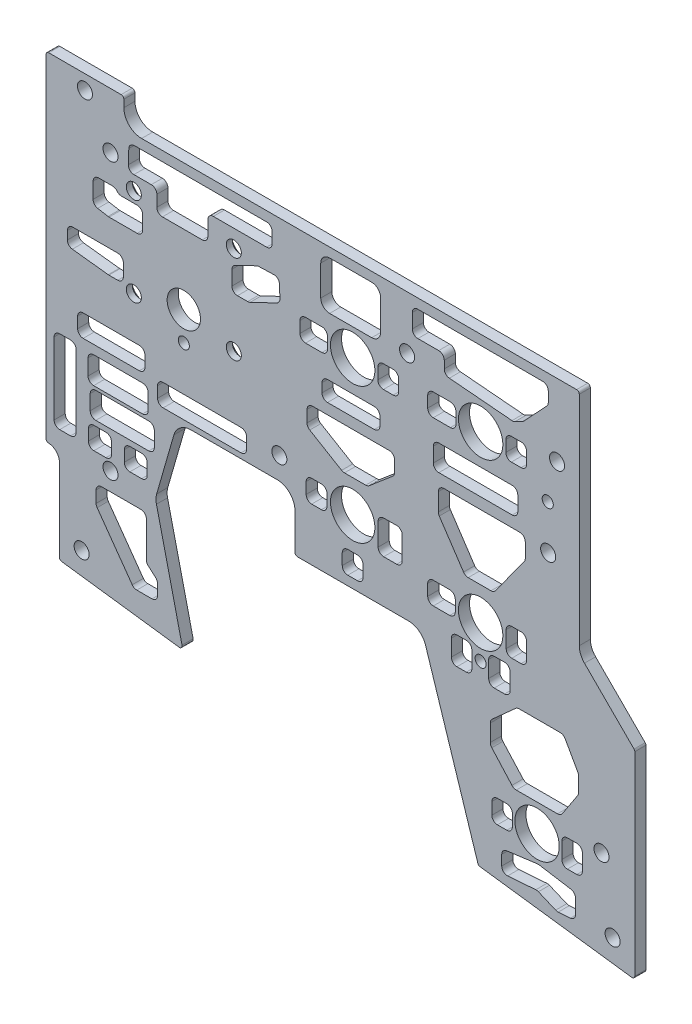
from build123d import *

# Parameters (mm, degrees)
BOSS_EXTRUDE1_DEPTH                       = 3.175
F_6_CLEARANCE_HOLE1_D                     = 4.3053
SKETCH4_R                                 = 6.35
SKETCH4_R_2                               = 1.5875
SKETCH4_R_3                               = 4.7625
CUT_EXTRUDE1_DEPTH                        = 218.405084842
CSK_FOR_6_FLAT_HEAD_MACHINE_SCREW_2_COUNT = 2
CSK_FOR_6_FLAT_HEAD_MACHINE_SCREW_2_PITCH = 28.575
CSK_FOR_6_FLAT_HEAD_MACHINE_SCREW_3_COUNT = 2
CSK_FOR_6_FLAT_HEAD_MACHINE_SCREW_3_PITCH = 38.232062788
CSK_FOR_6_FLAT_HEAD_MACHINE_SCREW_4_COUNT = 2
CSK_FOR_6_FLAT_HEAD_MACHINE_SCREW_4_PITCH = 25.4
F_0_CLEARANCE_HOLE1_D                     = 1.8542
F_1_8_0_125_DIAMETER_HOLE1_D              = 3.175
SKETCH17_R                                = 1.5875
CUT_EXTRUDE3_DEPTH                        = 218.405084842


with BuildPart() as part:
    # Sketch1 → Boss-Extrude1 (new body)
    with BuildSketch(Plane.XY):
        with BuildLine():
            Line((3.809986215, -91.884500325), (3.80998361, -115.403340545))
            ThreePointArc((3.80998361, -115.403340545), (3.999081622, -115.90576205), (4.472522544, -116.158821571))
            Line((4.472522544, -116.158821571), (38.023104274, -120.5758443))
            ThreePointArc((38.023104274, -120.5758443), (38.687459595, -120.33177166), (38.864463259, -119.646491316))
            Line((38.864463259, -119.646491316), (31.544635998, -88.413376307))
            ThreePointArc((31.544635998, -88.413376307), (31.412233483, -87.126289027), (31.609278422, -85.84750156))
            Line((31.609278422, -85.84750156), (36.533410401, -68.760772014))
            ThreePointArc((36.533410401, -68.760772014), (38.360231081, -66.108400459), (41.414754107, -65.0875))
            Line((41.414754107, -65.0875), (66.039990754, -65.0875))
            ThreePointArc((66.039990754, -65.0875), (69.632093202, -66.575397552), (71.119990754, -70.1675))
            Line((71.119990754, -70.1675), (71.119990754, -80.518))
            ThreePointArc((71.119990754, -80.518), (71.343175387, -81.056815367), (71.881990754, -81.28))
            Line((71.881990754, -81.28), (103.612235862, -81.28))
            ThreePointArc((103.612235862, -81.28), (106.604490402, -82.25478225), (108.448399818, -84.805034342))
            Line((108.448399818, -84.805034342), (123.423319929, -131.379161885))
            ThreePointArc((123.423319929, -131.379161885), (123.660593225, -131.731025839), (124.049283564, -131.901398021))
            Line((124.049283564, -131.901398021), (167.413526593, -137.610408921))
            ThreePointArc((167.413526593, -137.610408921), (168.015409063, -137.42782987), (168.274987552, -136.854927937))
            Line((168.274987552, -136.854927937), (168.274987552, -81.303553632))
            ThreePointArc((168.274987552, -81.303553632), (168.216983776, -81.011948907), (168.051802995, -80.764738341))
            Line((168.051802995, -80.764738341), (153.88788809, -66.600819412))
            ThreePointArc((153.88788809, -66.600819412), (152.786682817, -64.952748811), (152.399991049, -63.008717113))
            Line((152.399991049, -63.008717113), (152.399999892, -0.762021595))
            ThreePointArc((152.399999892, -0.762021595), (152.176815316, -0.223206231), (151.638, -2.1541e-05))
            Line((151.638, -2.1541e-05), (27.305, -3.804e-06))
            ThreePointArc((27.305, -3.804e-06), (23.712898123, 1.487894033), (22.22500087, 5.079996121))
            Line((22.22500087, 5.079996121), (22.225001755, 7.175496897))
            ThreePointArc((22.225001755, 7.175496897), (22.001816945, 7.7143128), (21.463001073, 7.937498421))
            Line((21.463001073, 7.937498421), (0.762001075, 7.937499892))
            ThreePointArc((0.762001075, 7.937499892), (0.223185691, 7.714315297), (1.021e-06, 7.175499945))
            Line((1.021e-06, 7.175499945), (-1.2342e-05, -87.949548922))
            ThreePointArc((-1.2342e-05, -87.949548922), (0.214550622, -88.479602508), (0.737406874, -88.711153328))
            ThreePointArc((0.737406874, -88.711153328), (2.915974038, -89.675944454), (3.809986215, -91.884500325))
        make_face()
    extrude(amount=-BOSS_EXTRUDE1_DEPTH)

    # #6 Clearance Hole1 (through all)
    with Locations(Plane(origin=(0, 0, -3.175), x_dir=(-1, 0, 0), z_dir=(0, 0, -1))):
        with Locations((-11.112500541, 3.81), (-18.414998872, -7.937503157), (-103.187497835, -15.240014658), (-143.510001128, -44.450020387), (-158.750001128, -111.125021649), (-18.414987678, -86.741003157), (-66.674991751, -58.7375), (-10.16, -110.502822935), (-146.049997068, -20.637520747), (-161.924987552, -130.483035149)):
            Hole(F_6_CLEARANCE_HOLE1_D / 2)

    # Sketch4 → Cut-Extrude1 (cut, through all)
    with BuildSketch(Plane(origin=(0, 0, -3.175), x_dir=(-1, 0, 0), z_dir=(0, 0, -1))):
        with Locations((-140.334987552, -115.57)):
            Circle(SKETCH4_R)
        with Locations((-124.205996572, -71.437521424)):
            Circle(SKETCH4_R)
        with Locations((-87.63, -62.992021649)):
            Circle(SKETCH4_R)
        with Locations((-87.63, -24.130021649)):
            Circle(SKETCH4_R)
        with Locations((-124.205996572, -24.130021649)):
            Circle(SKETCH4_R)
        with Locations((-124.205996572, -80.962521424)):
            Circle(SKETCH4_R_2)
        with Locations((-39.36999484, -36.322003157)):
            Circle(SKETCH4_R_3)
    extrude(amount=-CUT_EXTRUDE1_DEPTH, mode=Mode.SUBTRACT)

    # Sketch5 → CSK for #6 Flat Head Machine Screw (100)1 (revolve, cut)
    with BuildSketch(Plane(origin=(53.65749484, -14.097003157, -3.175), x_dir=(0, 1, 0), z_dir=(1, 0, 0))):
        Polygon((0, 0), (0, 3.175), (2.15265, 3.175), (2.15265, 1.420893136), (3.8460045, 0), align=None)
    csk_for_6_flat_head_machine_screw_100 = revolve(axis=Axis((53.65749484, -14.097003157, -9.525), (0, 0, 1)), mode=Mode.SUBTRACT)

    # CSK for _6 Flat Head Machine Screw _ 2: CSK for #6 Flat Head Machine Screw (100)1 ×2
    with Locations(*[(-i * CSK_FOR_6_FLAT_HEAD_MACHINE_SCREW_2_PITCH, 0, 0) for i in range(1, CSK_FOR_6_FLAT_HEAD_MACHINE_SCREW_2_COUNT)]):
        add(csk_for_6_flat_head_machine_screw_100, mode=Mode.SUBTRACT)

    # CSK for _6 Flat Head Machine Screw _ 3: CSK for #6 Flat Head Machine Screw (100)1 ×2
    with Locations(*[Vector(-0.7474093186836602, -0.6643638388299193, 0) * (i * CSK_FOR_6_FLAT_HEAD_MACHINE_SCREW_3_PITCH) for i in range(1, CSK_FOR_6_FLAT_HEAD_MACHINE_SCREW_3_COUNT)]):
        add(csk_for_6_flat_head_machine_screw_100, mode=Mode.SUBTRACT)

    # CSK for _6 Flat Head Machine Screw _ 4: CSK for #6 Flat Head Machine Screw (100)1 ×2
    with Locations(*[(0, -i * CSK_FOR_6_FLAT_HEAD_MACHINE_SCREW_4_PITCH, 0) for i in range(1, CSK_FOR_6_FLAT_HEAD_MACHINE_SCREW_4_COUNT)]):
        add(csk_for_6_flat_head_machine_screw_100, mode=Mode.SUBTRACT)

    # #0 Clearance Hole1 (through all)
    with Locations(Plane(origin=(0, 0, -9.525), x_dir=(-1, 0, 0), z_dir=(0, 0, -1))):
        with Locations((-39.36999484, -44.577003157)):
            Hole(F_0_CLEARANCE_HOLE1_D / 2)

    # 1/8 (0.125) Diameter Hole1 (through all)
    with Locations(Plane.XY):
        with Locations((39.36999484, -44.577003157)):
            Hole(F_1_8_0_125_DIAMETER_HOLE1_D / 2)

    # Sketch17 → Cut-Extrude3 (cut, through all)
    with BuildSketch(Plane(origin=(0, 0, 0), x_dir=(-1, 0, 0), z_dir=(0, 0, -1))):
        with Locations((-143.386523366, -31.863003467)):
            Circle(SKETCH17_R)
        with BuildLine():
            Line((-141.954401082, -2.794778722), (-106.266230354, -2.794778722))
            ThreePointArc((-106.266230354, -2.794778722), (-105.143698339, -3.259746707), (-104.678730354, -4.382278722))
            Line((-104.678730354, -4.382278722), (-104.678730354, -8.460645735))
            ThreePointArc((-104.678730354, -8.460645735), (-105.143698339, -9.58317775), (-106.266230354, -10.048145735))
            Line((-106.266230354, -10.048145735), (-112.220916292, -10.048145735))
            ThreePointArc((-112.220916292, -10.048145735), (-113.343448308, -10.513113719), (-113.808416292, -11.635645735))
            Line((-113.808416292, -11.635645735), (-113.808416292, -13.776242931))
            ThreePointArc((-113.808416292, -13.776242931), (-114.2259722, -14.849269991), (-115.258982682, -15.357826136))
            Line((-115.258982682, -15.357826136), (-133.159037644, -16.907614445))
            ThreePointArc((-133.159037644, -16.907614445), (-133.597603316, -16.884612116), (-134.01308492, -16.742330728))
            Line((-134.01308492, -16.742330728), (-136.087372049, -15.692058763))
            ThreePointArc((-136.087372049, -15.692058763), (-136.323169987, -15.545450468), (-136.529817195, -15.360000768))
            Line((-136.529817195, -15.360000768), (-143.113959892, -8.318487666))
            ThreePointArc((-143.113959892, -8.318487666), (-143.431045227, -7.817065459), (-143.541901082, -7.234246174))
            Line((-143.541901082, -7.234246174), (-143.541901082, -4.382278722))
            ThreePointArc((-143.541901082, -4.382278722), (-143.076933097, -3.259746707), (-141.954401082, -2.794778722))
        make_face()
        with BuildLine():
            Line((-93.066886854, -2.707621709), (-81.044131338, -2.707621709))
            ThreePointArc((-81.044131338, -2.707621709), (-79.248080114, -3.451570485), (-78.504131338, -5.247621709))
            Line((-78.504131338, -5.247621709), (-78.504131338, -13.895603213))
            ThreePointArc((-78.504131338, -13.895603213), (-79.248080114, -15.691654437), (-81.044131338, -16.435603213))
            Line((-81.044131338, -16.435603213), (-93.066886854, -16.435603213))
            ThreePointArc((-93.066886854, -16.435603213), (-94.862938078, -15.691654437), (-95.606886854, -13.895603213))
            Line((-95.606886854, -13.895603213), (-95.606886854, -5.247621709))
            ThreePointArc((-95.606886854, -5.247621709), (-94.862938078, -3.451570485), (-93.066886854, -2.707621709))
        make_face()
        with BuildLine():
            Line((-72.561223983, -22.437005333), (-72.561223983, -25.636983817))
            ThreePointArc((-72.561223983, -25.636983817), (-73.026191968, -26.759515832), (-74.148723983, -27.224483817))
            Line((-74.148723983, -27.224483817), (-78.851026484, -27.224483817))
            ThreePointArc((-78.851026484, -27.224483817), (-79.973558499, -26.759515832), (-80.438526484, -25.636983817))
            Line((-80.438526484, -25.636983817), (-80.438526484, -22.437005333))
            ThreePointArc((-80.438526484, -22.437005333), (-79.973558499, -21.314473318), (-78.851026484, -20.849505333))
            Line((-78.851026484, -20.849505333), (-74.148723983, -20.849505333))
            ThreePointArc((-74.148723983, -20.849505333), (-73.026191968, -21.314473318), (-72.561223983, -22.437005333))
        make_face()
        with BuildLine():
            Line((-99.201764697, -21.196263474), (-96.421279554, -21.196263474))
            ThreePointArc((-96.421279554, -21.196263474), (-95.298747539, -21.661231459), (-94.833779554, -22.783763474))
            Line((-94.833779554, -22.783763474), (-94.833779554, -25.981791856))
            ThreePointArc((-94.833779554, -25.981791856), (-95.298747539, -27.104323871), (-96.421279554, -27.569291856))
            Line((-96.421279554, -27.569291856), (-99.201764697, -27.569291856))
            ThreePointArc((-99.201764697, -27.569291856), (-100.324296712, -27.104323871), (-100.789264697, -25.981791856))
            Line((-100.789264697, -25.981791856), (-100.789264697, -22.783763474))
            ThreePointArc((-100.789264697, -22.783763474), (-100.324296712, -21.661231459), (-99.201764697, -21.196263474))
        make_face()
        with BuildLine():
            Line((-109.079202691, -22.654901792), (-109.079202691, -25.854880276))
            ThreePointArc((-109.079202691, -25.854880276), (-109.544170675, -26.977412291), (-110.666702691, -27.442380276))
            Line((-110.666702691, -27.442380276), (-115.553648816, -27.442380276))
            ThreePointArc((-115.553648816, -27.442380276), (-116.676180832, -26.977412291), (-117.141148816, -25.854880276))
            Line((-117.141148816, -25.854880276), (-117.141148816, -22.654901792))
            ThreePointArc((-117.141148816, -22.654901792), (-116.676180832, -21.532369777), (-115.553648816, -21.067401792))
            Line((-115.553648816, -21.067401792), (-110.666702691, -21.067401792))
            ThreePointArc((-110.666702691, -21.067401792), (-109.544170675, -21.532369777), (-109.079202691, -22.654901792))
        make_face()
        with BuildLine():
            Line((-135.77376345, -20.881443358), (-132.993278308, -20.881443358))
            ThreePointArc((-132.993278308, -20.881443358), (-131.870746293, -21.346411343), (-131.405778308, -22.468943358))
            Line((-131.405778308, -22.468943358), (-131.405778308, -25.666971739))
            ThreePointArc((-131.405778308, -25.666971739), (-131.870746293, -26.789503754), (-132.993278308, -27.254471739))
            Line((-132.993278308, -27.254471739), (-135.77376345, -27.254471739))
            ThreePointArc((-135.77376345, -27.254471739), (-136.896295465, -26.789503754), (-137.36126345, -25.666971739))
            Line((-137.36126345, -25.666971739), (-137.36126345, -22.468943358))
            ThreePointArc((-137.36126345, -22.468943358), (-136.896295465, -21.346411343), (-135.77376345, -20.881443358))
        make_face()
        with BuildLine():
            Line((-93.818924612, -33.08533813), (-80.438526484, -33.08533813))
            ThreePointArc((-80.438526484, -33.08533813), (-79.315994469, -33.550306115), (-78.851026484, -34.67283813))
            Line((-78.851026484, -34.67283813), (-78.851026484, -37.195409517))
            ThreePointArc((-78.851026484, -37.195409517), (-79.315994469, -38.317941532), (-80.438526484, -38.782909517))
            Line((-80.438526484, -38.782909517), (-93.818924612, -38.782909517))
            ThreePointArc((-93.818924612, -38.782909517), (-94.941456627, -38.317941532), (-95.406424612, -37.195409517))
            Line((-95.406424612, -37.195409517), (-95.406424612, -34.67283813))
            ThreePointArc((-95.406424612, -34.67283813), (-94.941456627, -33.550306115), (-93.818924612, -33.08533813))
        make_face()
        with BuildLine():
            Line((-133.234599807, -32.906340689), (-112.254202691, -32.906340689))
            ThreePointArc((-112.254202691, -32.906340689), (-111.131670675, -33.371308674), (-110.666702691, -34.493840689))
            Line((-110.666702691, -34.493840689), (-110.666702691, -38.654468066))
            ThreePointArc((-110.666702691, -38.654468066), (-111.131670675, -39.777000081), (-112.254202691, -40.241968066))
            Line((-112.254202691, -40.241968066), (-133.234599807, -40.241968066))
            ThreePointArc((-133.234599807, -40.241968066), (-134.357131822, -39.777000081), (-134.822099807, -38.654468066))
            Line((-134.822099807, -38.654468066), (-134.822099807, -34.493840689))
            ThreePointArc((-134.822099807, -34.493840689), (-134.357131822, -33.371308674), (-133.234599807, -32.906340689))
        make_face()
        with BuildLine():
            Line((-98.049772798, -41.846894397), (-76.171732084, -41.846894397))
            ThreePointArc((-76.171732084, -41.846894397), (-75.049200069, -42.311862382), (-74.584232084, -43.434394397))
            Line((-74.584232084, -43.434394397), (-74.584232084, -46.777135575))
            ThreePointArc((-74.584232084, -46.777135575), (-74.791626469, -47.561651185), (-75.359620735, -48.14118521))
            Line((-75.359620735, -48.14118521), (-84.465669031, -53.562633937))
            ThreePointArc((-84.465669031, -53.562633937), (-84.856634648, -53.729202648), (-85.277780379, -53.786084302))
            Line((-85.277780379, -53.786084302), (-91.347435578, -53.786084302))
            ThreePointArc((-91.347435578, -53.786084302), (-91.895147409, -53.68860712), (-92.375596997, -53.408146349))
            Line((-92.375596997, -53.408146349), (-99.077934217, -47.710973092))
            ThreePointArc((-99.077934217, -47.710973092), (-99.490668787, -47.167725534), (-99.637272798, -46.501411045))
            Line((-99.637272798, -46.501411045), (-99.637272798, -43.434394397))
            ThreePointArc((-99.637272798, -43.434394397), (-99.172304813, -42.311862382), (-98.049772798, -41.846894397))
        make_face()
        with BuildLine():
            Line((-135.378861596, -43.434394397), (-113.69903477, -43.434394397))
            ThreePointArc((-113.69903477, -43.434394397), (-112.576502755, -43.899362382), (-112.11153477, -45.021894397))
            Line((-112.11153477, -45.021894397), (-112.11153477, -50.042866363))
            ThreePointArc((-112.11153477, -50.042866363), (-112.179838766, -50.503517806), (-112.37887304, -50.924529143))
            Line((-112.37887304, -50.924529143), (-119.322930241, -61.322244422))
            ThreePointArc((-119.322930241, -61.322244422), (-119.894587933, -61.840545197), (-120.64309197, -62.028081642))
            Line((-120.64309197, -62.028081642), (-127.16320926, -62.028081642))
            ThreePointArc((-127.16320926, -62.028081642), (-127.884632872, -61.854690627), (-128.448464835, -61.372394047))
            Line((-128.448464835, -61.372394047), (-136.664117171, -50.040485491))
            ThreePointArc((-136.664117171, -50.040485491), (-136.888911177, -49.59847561), (-136.966361596, -49.108673086))
            Line((-136.966361596, -49.108673086), (-136.966361596, -45.021894397))
            ThreePointArc((-136.966361596, -45.021894397), (-136.501393611, -43.899362382), (-135.378861596, -43.434394397))
        make_face()
        with BuildLine():
            Line((-55.728459479, -57.317644253), (-33.458660867, -57.317644253))
            ThreePointArc((-33.458660867, -57.317644253), (-32.336128852, -57.782612238), (-31.871160867, -58.905144253))
            Line((-31.871160867, -58.905144253), (-31.871160867, -62.020016774))
            ThreePointArc((-31.871160867, -62.020016774), (-32.336128852, -63.142548789), (-33.458660867, -63.607516774))
            Line((-33.458660867, -63.607516774), (-55.728459479, -63.607516774))
            ThreePointArc((-55.728459479, -63.607516774), (-56.850991494, -63.142548789), (-57.315959479, -62.020016774))
            Line((-57.315959479, -62.020016774), (-57.315959479, -58.905144253))
            ThreePointArc((-57.315959479, -58.905144253), (-56.850991494, -57.782612238), (-55.728459479, -57.317644253))
        make_face()
        with BuildLine():
            Line((-78.702060135, -59.817431846), (-75.921574993, -59.817431846))
            ThreePointArc((-75.921574993, -59.817431846), (-74.799042977, -60.282399831), (-74.334074993, -61.404931846))
            Line((-74.334074993, -61.404931846), (-74.334074993, -64.602960227))
            ThreePointArc((-74.334074993, -64.602960227), (-74.799042977, -65.725492242), (-75.921574993, -66.190460227))
            Line((-75.921574993, -66.190460227), (-78.702060135, -66.190460227))
            ThreePointArc((-78.702060135, -66.190460227), (-79.82459215, -65.725492242), (-80.289560135, -64.602960227))
            Line((-80.289560135, -64.602960227), (-80.289560135, -61.404931846))
            ThreePointArc((-80.289560135, -61.404931846), (-79.82459215, -60.282399831), (-78.702060135, -59.817431846))
        make_face()
        with BuildLine():
            Line((-89.018858203, -72.254815082), (-86.23837306, -72.254815082))
            ThreePointArc((-86.23837306, -72.254815082), (-85.115841045, -72.719783067), (-84.65087306, -73.842315082))
            Line((-84.65087306, -73.842315082), (-84.65087306, -77.040343463))
            ThreePointArc((-84.65087306, -77.040343463), (-85.115841045, -78.162875478), (-86.23837306, -78.627843463))
            Line((-86.23837306, -78.627843463), (-89.018858203, -78.627843463))
            ThreePointArc((-89.018858203, -78.627843463), (-90.141390218, -78.162875478), (-90.606358203, -77.040343463))
            Line((-90.606358203, -77.040343463), (-90.606358203, -73.842315082))
            ThreePointArc((-90.606358203, -73.842315082), (-90.141390218, -72.719783067), (-89.018858203, -72.254815082))
        make_face()
        with BuildLine():
            Line((-109.075626661, -69.247984793), (-109.075626661, -72.447963277))
            ThreePointArc((-109.075626661, -72.447963277), (-109.540594645, -73.570495292), (-110.663126661, -74.035463277))
            Line((-110.663126661, -74.035463277), (-115.365429161, -74.035463277))
            ThreePointArc((-115.365429161, -74.035463277), (-116.487961176, -73.570495292), (-116.952929161, -72.447963277))
            Line((-116.952929161, -72.447963277), (-116.952929161, -69.247984793))
            ThreePointArc((-116.952929161, -69.247984793), (-116.487961176, -68.125452778), (-115.365429161, -67.660484793))
            Line((-115.365429161, -67.660484793), (-110.663126661, -67.660484793))
            ThreePointArc((-110.663126661, -67.660484793), (-109.540594645, -68.125452778), (-109.075626661, -69.247984793))
        make_face()
        with BuildLine():
            Line((-148.370050761, -88.076585208), (-151.957151361, -94.466108152))
            ThreePointArc((-151.957151361, -94.466108152), (-152.115789699, -94.859097254), (-152.169841465, -95.27943636))
            Line((-152.169841465, -95.27943636), (-152.169841465, -99.49161714))
            ThreePointArc((-152.169841465, -99.49161714), (-152.099935986, -99.968481356), (-151.89610216, -100.405217006))
            Line((-151.89610216, -100.405217006), (-147.55983031, -106.991698188))
            ThreePointArc((-147.55983031, -106.991698188), (-146.96032319, -107.540670714), (-146.17213864, -107.739529297))
            Line((-146.17213864, -107.739529297), (-134.392603774, -107.739529297))
            ThreePointArc((-134.392603774, -107.739529297), (-133.716535226, -107.595755795), (-133.157475142, -107.189318439))
            Line((-133.157475142, -107.189318439), (-127.395632153, -100.784991214))
            ThreePointArc((-127.395632153, -100.784991214), (-127.07956224, -100.268864333), (-126.96932981, -99.673771097))
            Line((-126.96932981, -99.673771097), (-126.96932981, -94.86683815))
            ThreePointArc((-126.96932981, -94.86683815), (-127.113103312, -94.190769602), (-127.519540668, -93.631709518))
            Line((-127.519540668, -93.631709518), (-134.162932699, -87.654784784))
            ThreePointArc((-134.162932699, -87.654784784), (-134.67905958, -87.338714871), (-135.274152816, -87.228482441))
            Line((-135.274152816, -87.228482441), (-146.92130989, -87.228482441))
            ThreePointArc((-146.92130989, -87.228482441), (-147.760673997, -87.456100045), (-148.370050761, -88.076585208))
        make_face()
        with BuildLine():
            Line((-137.36126345, -69.47417269), (-137.36126345, -74.171525295))
            ThreePointArc((-137.36126345, -74.171525295), (-136.896295465, -75.29405731), (-135.77376345, -75.759025295))
            Line((-135.77376345, -75.759025295), (-133.093247086, -75.759025295))
            ThreePointArc((-133.093247086, -75.759025295), (-131.970715071, -75.29405731), (-131.505747086, -74.171525295))
            Line((-131.505747086, -74.171525295), (-131.505747086, -69.481799172))
            ThreePointArc((-131.505747086, -69.481799172), (-131.969119323, -68.360865176), (-133.088730422, -67.894305597))
            Line((-133.088730422, -67.894305597), (-135.769246787, -67.886679115))
            ThreePointArc((-135.769246787, -67.886679115), (-136.894697446, -68.350044928), (-137.36126345, -69.47417269))
        make_face()
        with BuildLine():
            Line((-132.626442112, -79.356885677), (-132.626442112, -84.055009483))
            ThreePointArc((-132.626442112, -84.055009483), (-132.161474127, -85.177541498), (-131.038942112, -85.642509483))
            Line((-131.038942112, -85.642509483), (-128.087367926, -85.642509483))
            ThreePointArc((-128.087367926, -85.642509483), (-126.964835911, -85.177541498), (-126.499867926, -84.055009483))
            Line((-126.499867926, -84.055009483), (-126.499867926, -79.36528336))
            ThreePointArc((-126.499867926, -79.36528336), (-126.963240164, -78.244349364), (-128.082851263, -77.777789785))
            Line((-128.082851263, -77.777789785), (-131.034425449, -77.769392102))
            ThreePointArc((-131.034425449, -77.769392102), (-132.159876108, -78.232757914), (-132.626442112, -79.356885677))
        make_face()
        with BuildLine():
            Line((-121.693780245, -79.413986581), (-121.693780245, -84.111339186))
            ThreePointArc((-121.693780245, -84.111339186), (-121.22881226, -85.233871201), (-120.106280245, -85.698839186))
            Line((-120.106280245, -85.698839186), (-117.42576388, -85.698839186))
            ThreePointArc((-117.42576388, -85.698839186), (-116.303231865, -85.233871201), (-115.83826388, -84.111339186))
            Line((-115.83826388, -84.111339186), (-115.83826388, -79.421613063))
            ThreePointArc((-115.83826388, -79.421613063), (-116.301636118, -78.300679067), (-117.421247217, -77.834119488))
            Line((-117.421247217, -77.834119488), (-120.101763581, -77.826493007))
            ThreePointArc((-120.101763581, -77.826493007), (-121.227214241, -78.289858819), (-121.693780245, -79.413986581))
        make_face()
        with BuildLine():
            Line((-101.797793639, -60.937531848), (-101.797793639, -67.347277648))
            ThreePointArc((-101.797793639, -67.347277648), (-101.332825654, -68.469809663), (-100.210293639, -68.934777648))
            Line((-100.210293639, -68.934777648), (-96.497621556, -68.934777648))
            ThreePointArc((-96.497621556, -68.934777648), (-95.375089541, -68.469809663), (-94.910121556, -67.347277648))
            Line((-94.910121556, -67.347277648), (-94.910121556, -60.948094972))
            ThreePointArc((-94.910121556, -60.948094972), (-95.373493794, -59.827160976), (-96.493104893, -59.360601397))
            Line((-96.493104893, -59.360601397), (-100.205776975, -59.350038274))
            ThreePointArc((-100.205776975, -59.350038274), (-101.331227635, -59.813404086), (-101.797793639, -60.937531848))
        make_face()
        with BuildLine():
            Line((-153.280142062, -113.845353265), (-153.280142062, -118.411545226))
            ThreePointArc((-153.280142062, -118.411545226), (-152.815174077, -119.534077241), (-151.692642062, -119.999045226))
            Line((-151.692642062, -119.999045226), (-149.012125698, -119.999045226))
            ThreePointArc((-149.012125698, -119.999045226), (-147.889593683, -119.534077241), (-147.424625698, -118.411545226))
            Line((-147.424625698, -118.411545226), (-147.424625698, -113.852979747))
            ThreePointArc((-147.424625698, -113.852979747), (-147.887997935, -112.732045751), (-149.007609034, -112.265486172))
            Line((-149.007609034, -112.265486172), (-151.688125399, -112.25785969))
            ThreePointArc((-151.688125399, -112.25785969), (-152.813576058, -112.721225502), (-153.280142062, -113.845353265))
        make_face()
        with BuildLine():
            Line((-133.269582538, -114.060259814), (-133.269582538, -117.452210954))
            ThreePointArc((-133.269582538, -117.452210954), (-132.804614553, -118.57474297), (-131.682082538, -119.039710954))
            Line((-131.682082538, -119.039710954), (-129.001566173, -119.039710954))
            ThreePointArc((-129.001566173, -119.039710954), (-127.879034158, -118.57474297), (-127.414066173, -117.452210954))
            Line((-127.414066173, -117.452210954), (-127.414066173, -114.067886296))
            ThreePointArc((-127.414066173, -114.067886296), (-127.877438411, -112.9469523), (-128.99704951, -112.480392721))
            Line((-128.99704951, -112.480392721), (-131.677565874, -112.47276624))
            ThreePointArc((-131.677565874, -112.47276624), (-132.803016533, -112.936132052), (-133.269582538, -114.060259814))
        make_face()
        with BuildLine():
            Line((-150.008386995, -124.475096267), (-140.89017679, -122.992460461))
            ThreePointArc((-140.89017679, -122.992460461), (-140.658124621, -122.972044218), (-140.425582982, -122.985807167))
            Line((-140.425582982, -122.985807167), (-131.613885455, -124.16070017))
            ThreePointArc((-131.613885455, -124.16070017), (-130.629285574, -124.688549111), (-130.23619536, -125.734274463))
            Line((-130.23619536, -125.734274463), (-130.23619536, -128.629666423))
            ThreePointArc((-130.23619536, -128.629666423), (-130.742753538, -129.792301803), (-131.939150985, -130.212962431))
            Line((-131.939150985, -130.212962431), (-139.978069251, -129.626755984))
            ThreePointArc((-139.978069251, -129.626755984), (-140.352556122, -129.64382753), (-140.712598595, -129.748236689))
            Line((-140.712598595, -129.748236689), (-145.647124424, -131.837991292))
            ThreePointArc((-145.647124424, -131.837991292), (-146.007166897, -131.94240045), (-146.381653768, -131.959471997))
            Line((-146.381653768, -131.959471997), (-149.869058718, -131.705166729))
            ThreePointArc((-149.869058718, -131.705166729), (-150.916238473, -131.202812543), (-151.341103093, -130.121870721))
            Line((-151.341103093, -130.121870721), (-151.341103093, -126.042017265))
            ThreePointArc((-151.341103093, -126.042017265), (-150.962864375, -125.01350212), (-150.008386995, -124.475096267))
        make_face()
        with BuildLine():
            Line((-63.040443501, -2.794778722), (-25.227680135, -2.794778722))
            ThreePointArc((-25.227680135, -2.794778722), (-24.123242224, -3.241939671), (-23.640992035, -4.331513335))
            Line((-23.640992035, -4.331513335), (-23.510506479, -8.409880348))
            ThreePointArc((-23.510506479, -8.409880348), (-23.956855528, -9.565083646), (-25.097194578, -10.048145735))
            Line((-25.097194578, -10.048145735), (-30.072502828, -10.048145735))
            ThreePointArc((-30.072502828, -10.048145735), (-31.195034843, -10.513113719), (-31.660002828, -11.635645735))
            Line((-31.660002828, -11.635645735), (-31.660002828, -14.848103213))
            ThreePointArc((-31.660002828, -14.848103213), (-32.124970813, -15.970635228), (-33.247502828, -16.435603213))
            Line((-33.247502828, -16.435603213), (-44.640077745, -16.435603213))
            ThreePointArc((-44.640077745, -16.435603213), (-45.76260976, -15.970635228), (-46.227577745, -14.848103213))
            Line((-46.227577745, -14.848103213), (-46.227577745, -10.622419331))
            ThreePointArc((-46.227577745, -10.622419331), (-46.69254573, -9.499887316), (-47.815077745, -9.034919331))
            Line((-47.815077745, -9.034919331), (-63.040443501, -9.034919331))
            ThreePointArc((-63.040443501, -9.034919331), (-64.162975516, -8.569951347), (-64.627943501, -7.447419331))
            Line((-64.627943501, -7.447419331), (-64.627943501, -4.382278722))
            ThreePointArc((-64.627943501, -4.382278722), (-64.162975516, -3.259746707), (-63.040443501, -2.794778722))
        make_face()
        with BuildLine():
            Line((-14.759070115, -23.570795807), (-17.723350514, -24.090332102))
            ThreePointArc((-17.723350514, -24.090332102), (-17.85986161, -24.1081969), (-17.997407205, -24.114166799))
            Line((-17.997407205, -24.114166799), (-26.038134643, -24.114166799))
            ThreePointArc((-26.038134643, -24.114166799), (-27.160666659, -23.649198814), (-27.625634643, -22.526666799))
            Line((-27.625634643, -22.526666799), (-27.625634643, -18.73663863))
            ThreePointArc((-27.625634643, -18.73663863), (-27.160666659, -17.614106615), (-26.038134643, -17.14913863))
            Line((-26.038134643, -17.14913863), (-21.56318401, -17.14913863))
            ThreePointArc((-21.56318401, -17.14913863), (-20.962036583, -17.030916691), (-20.45042467, -16.693858971))
            Line((-20.45042467, -16.693858971), (-20.120376939, -16.369484217))
            ThreePointArc((-20.120376939, -16.369484217), (-19.608765026, -16.032426497), (-19.007617599, -15.914204558))
            Line((-19.007617599, -15.914204558), (-15.033126806, -15.914204558))
            ThreePointArc((-15.033126806, -15.914204558), (-13.910594791, -16.379172543), (-13.445626806, -17.501704558))
            Line((-13.445626806, -17.501704558), (-13.445626806, -22.007130504))
            ThreePointArc((-13.445626806, -22.007130504), (-13.817556725, -23.02818174), (-14.759070115, -23.570795807))
        make_face()
        with BuildLine():
            Line((-7.687541654, -31.784293999), (-20.492686013, -31.784293999))
            ThreePointArc((-20.492686013, -31.784293999), (-21.615218028, -32.249261984), (-22.080186013, -33.371793999))
            Line((-22.080186013, -33.371793999), (-22.080186013, -36.910471607))
            ThreePointArc((-22.080186013, -36.910471607), (-21.615218028, -38.033003622), (-20.492686013, -38.497971607))
            Line((-20.492686013, -38.497971607), (-17.950353288, -38.497971607))
            ThreePointArc((-17.950353288, -38.497971607), (-17.85932805, -38.495359823), (-17.768602325, -38.487533064))
            Line((-17.768602325, -38.487533064), (-7.505790692, -37.304778971))
            ThreePointArc((-7.505790692, -37.304778971), (-6.502491887, -36.784038157), (-6.100041654, -35.727717515))
            Line((-6.100041654, -35.727717515), (-6.100041654, -33.371793999))
            ThreePointArc((-6.100041654, -33.371793999), (-6.565009639, -32.249261984), (-7.687541654, -31.784293999))
        make_face()
        with BuildLine():
            Line((-54.017740764, -18.035287573), (-60.157042526, -15.096331818))
            ThreePointArc((-60.157042526, -15.096331818), (-60.467014119, -14.985764634), (-60.793122931, -14.941486718))
            Line((-60.793122931, -14.941486718), (-65.080511102, -14.808059257))
            ThreePointArc((-65.080511102, -14.808059257), (-66.216963147, -15.237884918), (-66.716623456, -16.345410507))
            Line((-66.716623456, -16.345410507), (-66.828160076, -19.929386283))
            ThreePointArc((-66.828160076, -19.929386283), (-66.597618952, -20.803935361), (-65.926889232, -21.410653537))
            Line((-65.926889232, -21.410653537), (-58.302186243, -25.06068828))
            ThreePointArc((-58.302186243, -25.06068828), (-57.968176642, -25.176909518), (-57.616725286, -25.216301578))
            Line((-57.616725286, -25.216301578), (-54.703201722, -25.216301578))
            ThreePointArc((-54.703201722, -25.216301578), (-53.580669707, -24.751333593), (-53.115701722, -23.628801578))
            Line((-53.115701722, -23.628801578), (-53.115701722, -19.467174274))
            ThreePointArc((-53.115701722, -19.467174274), (-53.360010462, -18.621010289), (-54.017740764, -18.035287573))
        make_face()
        with BuildLine():
            Line((-24.6224405, -111.814164533), (-14.598619876, -97.7476148))
            ThreePointArc((-14.598619876, -97.7476148), (-14.379412328, -97.309967584), (-14.303951845, -96.826342988))
            Line((-14.303951845, -96.826342988), (-14.303951845, -93.511282851))
            ThreePointArc((-14.303951845, -93.511282851), (-14.76891983, -92.388750836), (-15.891451845, -91.923782851))
            Line((-15.891451845, -91.923782851), (-27.085798239, -91.923782851))
            ThreePointArc((-27.085798239, -91.923782851), (-28.208330254, -92.388750836), (-28.673298239, -93.511282851))
            Line((-28.673298239, -93.511282851), (-28.673298239, -103.655996614))
            ThreePointArc((-28.673298239, -103.655996614), (-28.814136203, -104.309697772), (-29.2116607, -104.847410343))
            Line((-29.2116607, -104.847410343), (-31.332798405, -106.715246122))
            ThreePointArc((-31.332798405, -106.715246122), (-31.730322903, -107.252958694), (-31.871160867, -107.906659851))
            Line((-31.871160867, -107.906659851), (-31.871160867, -110.892892721))
            ThreePointArc((-31.871160867, -110.892892721), (-31.406192882, -112.015424736), (-30.283660867, -112.480392721))
            Line((-30.283660867, -112.480392721), (-25.915272469, -112.480392721))
            ThreePointArc((-25.915272469, -112.480392721), (-25.188073304, -112.304040348), (-24.6224405, -111.814164533))
        make_face()
        with BuildLine():
            Line((-2.29761601, -61.626856011), (-2.29761601, -82.185869764))
            ThreePointArc((-2.29761601, -82.185869764), (-2.762583995, -83.308401779), (-3.88511601, -83.773369764))
            Line((-3.88511601, -83.773369764), (-6.992649062, -83.773369764))
            ThreePointArc((-6.992649062, -83.773369764), (-8.115181078, -83.308401779), (-8.580149062, -82.185869764))
            Line((-8.580149062, -82.185869764), (-8.580149062, -61.626856011))
            ThreePointArc((-8.580149062, -61.626856011), (-8.115181078, -60.504323996), (-6.992649062, -60.039356011))
            Line((-6.992649062, -60.039356011), (-3.88511601, -60.039356011))
            ThreePointArc((-3.88511601, -60.039356011), (-2.762583995, -60.504323996), (-2.29761601, -61.626856011))
        make_face()
        with BuildLine():
            Line((-26.655047824, -51.539248395), (-10.603917238, -51.539248395))
            ThreePointArc((-10.603917238, -51.539248395), (-9.481385223, -52.00421638), (-9.016417238, -53.126748395))
            Line((-9.016417238, -53.126748395), (-9.016417238, -56.241620915))
            ThreePointArc((-9.016417238, -56.241620915), (-9.481385223, -57.364152931), (-10.603917238, -57.829120915))
            Line((-10.603917238, -57.829120915), (-26.655047824, -57.829120915))
            ThreePointArc((-26.655047824, -57.829120915), (-27.777579839, -57.364152931), (-28.242547824, -56.241620915))
            Line((-28.242547824, -56.241620915), (-28.242547824, -53.126748395))
            ThreePointArc((-28.242547824, -53.126748395), (-27.777579839, -52.00421638), (-26.655047824, -51.539248395))
        make_face()
        with BuildLine():
            Line((-27.60517637, -60.384955933), (-13.586583905, -60.384955933))
            ThreePointArc((-13.586583905, -60.384955933), (-12.464051889, -60.849923918), (-11.999083905, -61.972455933))
            Line((-11.999083905, -61.972455933), (-11.999083905, -66.454374219))
            ThreePointArc((-11.999083905, -66.454374219), (-12.464051889, -67.576906234), (-13.586583905, -68.041874219))
            Line((-13.586583905, -68.041874219), (-27.60517637, -68.041874219))
            ThreePointArc((-27.60517637, -68.041874219), (-28.727708385, -67.576906234), (-29.19267637, -66.454374219))
            Line((-29.19267637, -66.454374219), (-29.19267637, -61.972455933))
            ThreePointArc((-29.19267637, -61.972455933), (-28.727708385, -60.849923918), (-27.60517637, -60.384955933))
        make_face()
        with BuildLine():
            Line((-29.346999145, -68.903193864), (-14.201372964, -68.903193864))
            ThreePointArc((-14.201372964, -68.903193864), (-13.078840949, -69.368161849), (-12.613872964, -70.490693864))
            Line((-12.613872964, -70.490693864), (-12.613872964, -74.741182613))
            ThreePointArc((-12.613872964, -74.741182613), (-13.078840949, -75.863714628), (-14.201372964, -76.328682613))
            Line((-14.201372964, -76.328682613), (-29.346999145, -76.328682613))
            ThreePointArc((-29.346999145, -76.328682613), (-30.46953116, -75.863714628), (-30.934499145, -74.741182613))
            Line((-30.934499145, -74.741182613), (-30.934499145, -70.490693864))
            ThreePointArc((-30.934499145, -70.490693864), (-30.46953116, -69.368161849), (-29.346999145, -68.903193864))
        make_face()
        with BuildLine():
            Line((-27.328678764, -77.907601358), (-23.948133638, -77.907601358))
            ThreePointArc((-23.948133638, -77.907601358), (-22.825601623, -78.372569343), (-22.360633638, -79.495101358))
            Line((-22.360633638, -79.495101358), (-22.360633638, -82.609973878))
            ThreePointArc((-22.360633638, -82.609973878), (-22.825601623, -83.732505893), (-23.948133638, -84.197473878))
            Line((-23.948133638, -84.197473878), (-27.328678764, -84.197473878))
            ThreePointArc((-27.328678764, -84.197473878), (-28.45121078, -83.732505893), (-28.916178764, -82.609973878))
            Line((-28.916178764, -82.609973878), (-28.916178764, -79.495101358))
            ThreePointArc((-28.916178764, -79.495101358), (-28.45121078, -78.372569343), (-27.328678764, -77.907601358))
        make_face()
        with BuildLine():
            Line((-17.11922324, -77.821029951), (-13.667032811, -77.821029951))
            ThreePointArc((-13.667032811, -77.821029951), (-12.544500796, -78.285997936), (-12.079532811, -79.408529951))
            Line((-12.079532811, -79.408529951), (-12.079532811, -82.523402472))
            ThreePointArc((-12.079532811, -82.523402472), (-12.544500796, -83.645934487), (-13.667032811, -84.110902472))
            Line((-13.667032811, -84.110902472), (-17.11922324, -84.110902472))
            ThreePointArc((-17.11922324, -84.110902472), (-18.241755255, -83.645934487), (-18.70672324, -82.523402472))
            Line((-18.70672324, -82.523402472), (-18.70672324, -79.408529951))
            ThreePointArc((-18.70672324, -79.408529951), (-18.241755255, -78.285997936), (-17.11922324, -77.821029951))
        make_face()
    extrude(amount=CUT_EXTRUDE3_DEPTH, mode=Mode.SUBTRACT)


solid = part.part
